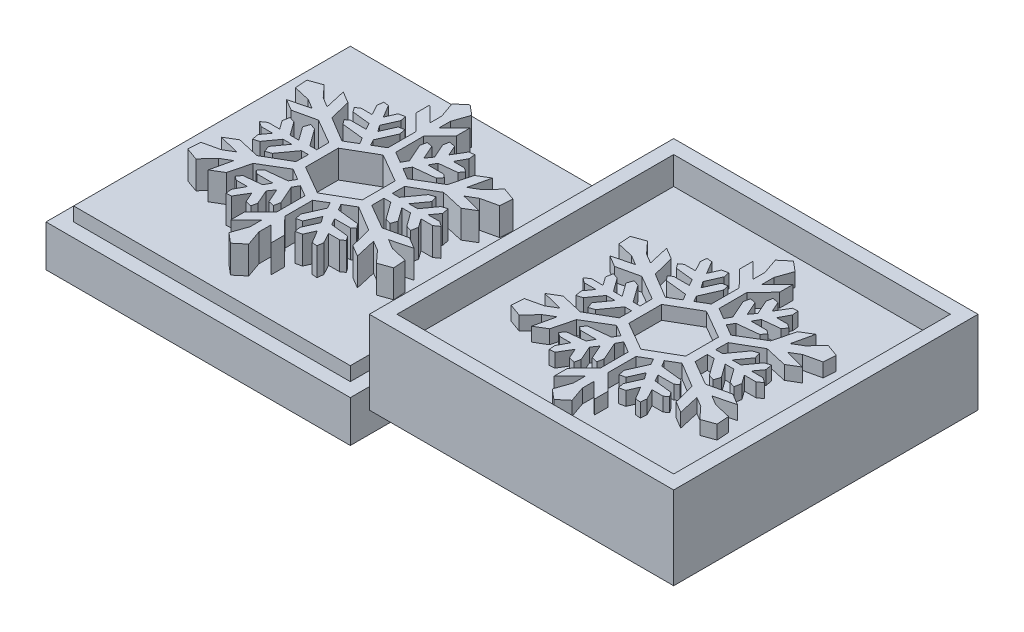
from build123d import *

# Parameters (mm, degrees)
CROQUIS1_W                                   = 110
CROQUIS1_H                                   = 110
SALIENTE_EXTRUIR1_DEPTH                      = 20
MATRIZ_START                                 = 12.5
MATRIZ_PARA_COPO_DE_NIEVE_INST_OUTLINE_W     = 110
MATRIZ_PARA_COPO_DE_NIEVE_INST_OUTLINE_H     = 110
MATRIZ_PARA_COPO_DE_NIEVE_INST_DEPTH         = 20
MATRIZ_START_2                               = 32.5
MATRIZ_PARA_COPO_DE_NIEVE_INST_2_OUTLINE_W   = 110
MATRIZ_PARA_COPO_DE_NIEVE_INST_2_OUTLINE_H   = 110
MATRIZ_PARA_COPO_DE_NIEVE_INST_2_OUTLINE_W_2 = 100
MATRIZ_PARA_COPO_DE_NIEVE_INST_2_OUTLINE_H_2 = 100
MATRIZ_PARA_COPO_DE_NIEVE_INST_2_DEPTH       = 10
MATRIZ_PARA_COPO_DE_NIEVE_INST_3_DEPTH       = 5
CROQUIS2_W                                   = 110
CROQUIS2_H                                   = 110
CROQUIS2_W_2                                 = 100
CROQUIS2_H_2                                 = 100
CORTAR_EXTRUIR2_DEPTH                        = 5
SALIENTE_EXTRUIR2_DEPTH                      = 10


# Read off the part's stored shape, not the designer's step: matriz para copo de nieve inst
with BuildPart() as part:
    # Croquis1 → Saliente-Extruir1 (new body)
    with BuildSketch(Plane(origin=(0, 0, 0), x_dir=(1, 0, 0), z_dir=(0, 1, 0))):
        Rectangle(CROQUIS1_W, CROQUIS1_H)
    extrude(amount=SALIENTE_EXTRUIR1_DEPTH)

    # Croquis2 → Cortar-Extruir2 (cut)
    with BuildSketch(Plane(origin=(0, 20, 0), x_dir=(1, 0, 0), z_dir=(0, 1, 0))):
        Rectangle(CROQUIS2_W, CROQUIS2_H)
        Rectangle(CROQUIS2_W_2, CROQUIS2_H_2, mode=Mode.SUBTRACT)
    extrude(amount=-CORTAR_EXTRUIR2_DEPTH, mode=Mode.SUBTRACT)

    # Croquis3 → Saliente-Extruir2 (add)
    with BuildSketch(Plane(origin=(0, 20, 0), x_dir=(1, 0, 0), z_dir=(0, 1, 0))):
        Polygon((1.401750865, -15.024505482), (1.401750865, -25.082026445), (7.24046247, -31.053498659), (7.24046247, -35.944123141), (1.601246458, -30.344502802), (1.601246458, -34.62741655), (3.576654108, -40.299383405), (0, -43.308998471), (-3.576654108, -40.299383405), (-1.601246458, -34.62741655), (-1.601246458, -30.344502802), (-7.24046247, -35.944123141), (-7.24046247, -31.053498659), (-1.401750865, -25.082026445), (-1.401750865, -15.024505482), (-5.366397426, -12.668526031), (-6.553491469, -14.828021821), (-3.591131353, -21.513153795), (-4.043357191, -23.757533882), (-6.088103363, -23.345532788), (-8.342582526, -18.257869523), (-9.950365645, -20.524956593), (-7.588789114, -25.854305545), (-8.008622187, -27.937921538), (-10.181938561, -27.500014507), (-11.840331452, -23.757533882), (-14.557396536, -28.329816013), (-16.453298086, -28.525494001), (-16.685581739, -26.274924382), (-14.675689124, -22.536524118), (-18.691859369, -22.536524118), (-20.099896599, -21.537965872), (-18.945472608, -19.910147), (-12.480590093, -19.217261965), (-11.178475974, -16.848528018), (-16.886571, -16.848528018), (-18.152803347, -15.857491773), (-16.886571, -14.239645438), (-9.100363099, -13.405145055), (-7.802403677, -11.220936547), (-11.840331452, -8.821409952), (-20.887971279, -14.239645438), (-22.856293838, -21.955271204), (-26.95258016, -24.408357792), (-25.240992324, -16.848528018), (-28.748223024, -18.948854976), (-32.6411281, -23.181814498), (-37.221263287, -21.537965872), (-36.924320104, -17.081609197), (-30.926257151, -15.712777024), (-27.462068783, -13.638226234), (-34.810379623, -11.763608874), (-30.680733119, -9.290544333), (-22.620463637, -11.115434525), (-13.708215403, -5.959407612), (-13.652264332, -1.511972751), (-16.150867319, -1.511972751), (-20.556839856, -7.642319112), (-22.639157972, -8.340866636), (-23.381693859, -6.127422488), (-19.896981445, -1.278891572), (-23.050573262, -1.278891572), (-26.535285676, -6.127422488), (-28.571013719, -6.810340614), (-29.01659951, -4.344064752), (-26.813613241, -1.278891572), (-31.025246179, -1.278891572), (-32.80465997, 0), (-31.025246179, 1.278891572), (-26.813613241, 1.278891572), (-29.01659951, 4.344064752), (-28.571013719, 6.810340614), (-26.535285676, 6.127422488), (-23.050573262, 1.278891572), (-19.896981445, 1.278891572), (-23.381693859, 6.127422488), (-22.639157972, 8.340866636), (-20.556839856, 7.642319112), (-16.150867319, 1.511972751), (-13.652264332, 1.511972751), (-13.708215403, 5.959407612), (-22.620463637, 11.115434525), (-30.680733119, 9.290544333), (-34.810379623, 11.763608874), (-27.462068783, 13.638226234), (-30.926257151, 15.712777024), (-36.924320104, 17.081609197), (-37.221263287, 21.537965872), (-32.6411281, 23.181814498), (-28.748223024, 18.948854976), (-25.240992324, 16.848528018), (-26.95258016, 24.408357792), (-22.856293838, 21.955271204), (-20.887971279, 14.239645438), (-11.840331452, 8.821409952), (-7.802403677, 11.220936547), (-9.100363099, 13.405145055), (-16.886571, 14.239645438), (-18.152803347, 15.857491773), (-16.886571, 16.848528018), (-11.178475974, 16.848528018), (-12.480590093, 19.217261965), (-18.945472608, 19.910147), (-20.099896599, 21.537965872), (-18.691859369, 22.536524118), (-14.675689124, 22.536524118), (-16.685581739, 26.274924382), (-16.453298086, 28.525494001), (-14.557396536, 28.329816013), (-11.840331452, 23.757533882), (-10.181938561, 27.500014507), (-8.008622187, 27.937921538), (-7.588789114, 25.854305545), (-9.950365645, 20.524956593), (-8.342582526, 18.257869523), (-6.088103363, 23.345532788), (-4.043357191, 23.757533882), (-3.591131353, 21.513153795), (-6.553491469, 14.828021821), (-5.366397426, 12.668526031), (-1.401750865, 15.024505482), (-1.401750865, 25.082026445), (-7.24046247, 31.053498659), (-7.24046247, 35.944123141), (-1.601246458, 30.344502802), (-1.601246458, 34.62741655), (-3.576654108, 40.299383405), (0, 43.308998471), (3.576654108, 40.299383405), (1.601246458, 34.62741655), (1.601246458, 30.344502802), (7.24046247, 35.944123141), (7.24046247, 31.053498659), (1.401750865, 25.082026445), (1.401750865, 15.024505482), (5.366397426, 12.668526031), (6.553491469, 14.828021821), (3.591131353, 21.513153795), (4.043357191, 23.757533882), (6.088103363, 23.345532788), (8.342582526, 18.257869523), (9.950365645, 20.524956593), (7.588789114, 25.854305545), (8.008622187, 27.937921538), (10.181938561, 27.500014507), (11.840331452, 23.757533882), (14.557396536, 28.329816013), (16.453298086, 28.525494001), (16.685581739, 26.274924382), (14.675689124, 22.536524118), (18.691859369, 22.536524118), (20.099896599, 21.537965872), (18.945472608, 19.910147), (12.480590093, 19.217261965), (11.178475974, 16.848528018), (16.886571, 16.848528018), (18.152803347, 15.857491773), (16.886571, 14.239645438), (9.100363099, 13.405145055), (7.802403677, 11.220936547), (11.840331452, 8.821409952), (20.887971279, 14.239645438), (22.856293838, 21.955271204), (26.95258016, 24.408357792), (25.240992324, 16.848528018), (28.748223024, 18.948854976), (32.6411281, 23.181814498), (37.221263287, 21.537965872), (36.924320104, 17.081609197), (30.926257151, 15.712777024), (27.462068783, 13.638226234), (34.810379623, 11.763608874), (30.680733119, 9.290544333), (22.620463637, 11.115434525), (13.708215403, 5.959407612), (13.652264332, 1.511972751), (16.150867319, 1.511972751), (20.556839856, 7.642319112), (22.639157972, 8.340866636), (23.381693859, 6.127422488), (19.896981445, 1.278891572), (23.050573262, 1.278891572), (26.535285676, 6.127422488), (28.571013719, 6.810340614), (29.01659951, 4.344064752), (26.813613241, 1.278891572), (31.025246179, 1.278891572), (32.80465997, 0), (31.025246179, -1.278891572), (26.813613241, -1.278891572), (29.01659951, -4.344064752), (28.571013719, -6.810340614), (26.535285676, -6.127422488), (23.050573262, -1.278891572), (19.896981445, -1.278891572), (23.381693859, -6.127422488), (22.639157972, -8.340866636), (20.556839856, -7.642319112), (16.150867319, -1.511972751), (13.652264332, -1.511972751), (13.708215403, -5.959407612), (22.620463637, -11.115434525), (30.680733119, -9.290544333), (34.810379623, -11.763608874), (27.462068783, -13.638226234), (30.926257151, -15.712777024), (36.924320104, -17.081609197), (37.221263287, -21.537965872), (32.6411281, -23.181814498), (28.748223024, -18.948854976), (25.240992324, -16.848528018), (26.95258016, -24.408357792), (22.856293838, -21.955271204), (20.887971279, -14.239645438), (11.840331452, -8.821409952), (7.802403677, -11.220936547), (9.100363099, -13.405145055), (16.886571, -14.239645438), (18.152803347, -15.857491773), (16.886571, -16.848528018), (11.178475974, -16.848528018), (12.480590093, -19.217261965), (18.945472608, -19.910147), (20.099896599, -21.537965872), (18.691859369, -22.536524118), (14.675689124, -22.536524118), (16.685581739, -26.274924382), (16.453298086, -28.525494001), (14.557396536, -28.329816013), (11.840331452, -23.757533882), (10.181938561, -27.500014507), (8.008622187, -27.937921538), (7.588789114, -25.854305545), (9.950365645, -20.524956593), (8.342582526, -18.257869523), (6.088103363, -23.345532788), (4.043357191, -23.757533882), (3.591131353, -21.513153795), (6.553491469, -14.828021821), (5.366397426, -12.668526031), align=None)
        Polygon((10.26956557, -5.929136446), (10.26956557, 5.929136446), (0, 11.858272893), (-10.26956557, 5.929136446), (-10.26956557, -5.929136446), (0, -11.858272893), align=None, mode=Mode.SUBTRACT)
    extrude(amount=SALIENTE_EXTRUIR2_DEPTH)


with BuildPart() as body_2:
    # matriz para copo de nieve inst outline → matriz para copo de nieve inst (new body)
    with BuildSketch(Plane(origin=(0, 0, 0), x_dir=(1, 0, 0), z_dir=(0, 1, 0)).offset(MATRIZ_START)):
        with Locations((114.843651792, 2.026652679)):
            Rectangle(MATRIZ_PARA_COPO_DE_NIEVE_INST_OUTLINE_W, MATRIZ_PARA_COPO_DE_NIEVE_INST_OUTLINE_H)
    extrude(amount=MATRIZ_PARA_COPO_DE_NIEVE_INST_DEPTH)

    # matriz para copo de nieve inst 2 outline → matriz para copo de nieve inst 2 (add)
    with BuildSketch(Plane(origin=(0, 0, 0), x_dir=(1, 0, 0), z_dir=(0, 1, 0)).offset(MATRIZ_START_2)):
        with Locations((114.843651792, 2.026652679)):
            Rectangle(MATRIZ_PARA_COPO_DE_NIEVE_INST_2_OUTLINE_W, MATRIZ_PARA_COPO_DE_NIEVE_INST_2_OUTLINE_H)
        with Locations((114.843651792, 2.026652679)):
            Rectangle(MATRIZ_PARA_COPO_DE_NIEVE_INST_2_OUTLINE_W_2, MATRIZ_PARA_COPO_DE_NIEVE_INST_2_OUTLINE_H_2, mode=Mode.SUBTRACT)
    extrude(amount=MATRIZ_PARA_COPO_DE_NIEVE_INST_2_DEPTH)

    # matriz para copo de nieve inst 3 outline → matriz para copo de nieve inst 3 (add)
    with BuildSketch(Plane(origin=(0, 0, 0), x_dir=(1, 0, 0), z_dir=(0, 1, 0)).offset(MATRIZ_START_2)):
        Polygon((116.245402657, -12.997852803), (120.210049217, -10.641873352), (121.39714326, -12.801369143), (118.434783144, -19.486501117), (118.887008983, -21.730881203), (120.931755154, -21.318880109), (123.186234317, -16.231216844), (124.794017437, -18.498303914), (122.432440905, -23.827652867), (122.852273979, -25.911268859), (125.025590352, -25.473361829), (126.683983243, -21.730881203), (129.401048328, -26.303163334), (131.296949878, -26.498841323), (131.52923353, -24.248271703), (129.519340915, -20.50987144), (133.53551116, -20.50987144), (134.94354839, -19.511313193), (133.7891244, -17.883494322), (127.324241884, -17.190609286), (126.022127765, -14.82187534), (131.730222792, -14.82187534), (132.996455139, -13.830839094), (131.730222792, -12.212992759), (123.944014891, -11.378492376), (122.646055468, -9.194283868), (126.683983243, -6.794757274), (135.73162307, -12.212992759), (137.69994563, -19.928618525), (141.796231952, -22.381705113), (140.084644115, -14.82187534), (143.591874815, -16.922202298), (147.484779892, -21.155161819), (152.064915078, -19.511313193), (151.767971896, -15.054956519), (145.769908943, -13.686124345), (142.305720574, -11.611573555), (149.654031415, -9.736956195), (145.524384911, -7.263891655), (137.464115429, -9.088781847), (128.551867195, -3.932754934), (128.495916123, 0.514679928), (130.99451911, 0.514679928), (135.400491648, -5.615666433), (137.482809764, -6.314213957), (138.22534565, -4.10076981), (134.740633236, 0.747761107), (137.894225054, 0.747761107), (141.378937468, -4.10076981), (143.41466551, -4.783687935), (143.860251301, -2.317412074), (141.657265032, 0.747761107), (145.868897971, 0.747761107), (147.648311761, 2.026652679), (145.868897971, 3.30554425), (141.657265032, 3.30554425), (143.860251301, 6.370717431), (143.41466551, 8.836993292), (141.378937468, 8.154075167), (137.894225054, 3.30554425), (134.740633236, 3.30554425), (138.22534565, 8.154075167), (137.482809764, 10.367519315), (135.400491648, 9.668971791), (130.99451911, 3.538625429), (128.495916123, 3.538625429), (128.551867195, 7.986060291), (137.464115429, 13.142087204), (145.524384911, 11.317197012), (149.654031415, 13.790261553), (142.305720574, 15.664878913), (145.769908943, 17.739429702), (151.767971896, 19.108261876), (152.064915078, 23.56461855), (147.484779892, 25.208467177), (143.591874815, 20.975507655), (140.084644115, 18.875180697), (141.796231952, 26.435010471), (137.69994563, 23.981923883), (135.73162307, 16.266298117), (126.683983243, 10.848062631), (122.646055468, 13.247589226), (123.944014891, 15.431797734), (131.730222792, 16.266298117), (132.996455139, 17.884144451), (131.730222792, 18.875180697), (126.022127765, 18.875180697), (127.324241884, 21.243914644), (133.7891244, 21.936799679), (134.94354839, 23.56461855), (133.53551116, 24.563176797), (129.519340915, 24.563176797), (131.52923353, 28.301577061), (131.296949878, 30.55214668), (129.401048328, 30.356468691), (126.683983243, 25.784186561), (125.025590352, 29.526667186), (122.852273979, 29.964574217), (122.432440905, 27.880958224), (124.794017437, 22.551609272), (123.186234317, 20.284522202), (120.931755154, 25.372185466), (118.887008983, 25.784186561), (118.434783144, 23.539806474), (121.39714326, 16.8546745), (120.210049217, 14.69517871), (116.245402657, 17.05115816), (116.245402657, 27.108679124), (122.084114261, 33.080151338), (122.084114261, 37.97077582), (116.44489825, 32.371155481), (116.44489825, 36.654069229), (118.4203059, 42.326036083), (114.843651792, 45.335651149), (111.266997684, 42.326036083), (113.242405333, 36.654069229), (113.242405333, 32.371155481), (107.603189322, 37.97077582), (107.603189322, 33.080151338), (113.441900926, 27.108679124), (113.441900926, 17.05115816), (109.477254366, 14.69517871), (108.290160323, 16.8546745), (111.252520439, 23.539806474), (110.8002946, 25.784186561), (108.755548429, 25.372185466), (106.501069266, 20.284522202), (104.893286146, 22.551609272), (107.254862678, 27.880958224), (106.835029605, 29.964574217), (104.661713231, 29.526667186), (103.00332034, 25.784186561), (100.286255255, 30.356468691), (98.390353705, 30.55214668), (98.158070053, 28.301577061), (100.167962668, 24.563176797), (96.151792423, 24.563176797), (94.743755193, 23.56461855), (95.898179184, 21.936799679), (102.363061699, 21.243914644), (103.665175818, 18.875180697), (97.957080791, 18.875180697), (96.690848444, 17.884144451), (97.957080791, 16.266298117), (105.743288692, 15.431797734), (107.041248115, 13.247589226), (103.00332034, 10.848062631), (93.955680513, 16.266298117), (91.987357953, 23.981923883), (87.891071631, 26.435010471), (89.602659468, 18.875180697), (86.095428768, 20.975507655), (82.202523691, 25.208467177), (77.622388505, 23.56461855), (77.919331687, 19.108261876), (83.917394641, 17.739429702), (87.381583009, 15.664878913), (80.033272168, 13.790261553), (84.162918672, 11.317197012), (92.223188154, 13.142087204), (101.135436388, 7.986060291), (101.19138746, 3.538625429), (98.692784473, 3.538625429), (94.286811935, 9.668971791), (92.20449382, 10.367519315), (91.461957933, 8.154075167), (94.946670347, 3.30554425), (91.793078529, 3.30554425), (88.308366115, 8.154075167), (86.272638073, 8.836993292), (85.827052282, 6.370717431), (88.030038551, 3.30554425), (83.818405612, 3.30554425), (82.038991822, 2.026652679), (83.818405612, 0.747761107), (88.030038551, 0.747761107), (85.827052282, -2.317412074), (86.272638073, -4.783687935), (88.308366115, -4.10076981), (91.793078529, 0.747761107), (94.946670347, 0.747761107), (91.461957933, -4.10076981), (92.20449382, -6.314213957), (94.286811935, -5.615666433), (98.692784473, 0.514679928), (101.19138746, 0.514679928), (101.135436388, -3.932754934), (92.223188154, -9.088781847), (84.162918672, -7.263891655), (80.033272168, -9.736956195), (87.381583009, -11.611573555), (83.917394641, -13.686124345), (77.919331687, -15.054956519), (77.622388505, -19.511313193), (82.202523691, -21.155161819), (86.095428768, -16.922202298), (89.602659468, -14.82187534), (87.891071631, -22.381705113), (91.987357953, -19.928618525), (93.955680513, -12.212992759), (103.00332034, -6.794757274), (107.041248115, -9.194283868), (105.743288692, -11.378492376), (97.957080791, -12.212992759), (96.690848444, -13.830839094), (97.957080791, -14.82187534), (103.665175818, -14.82187534), (102.363061699, -17.190609286), (95.898179184, -17.883494322), (94.743755193, -19.511313193), (96.151792423, -20.50987144), (100.167962668, -20.50987144), (98.158070053, -24.248271703), (98.390353705, -26.498841323), (100.286255255, -26.303163334), (103.00332034, -21.730881203), (104.661713231, -25.473361829), (106.835029605, -25.911268859), (107.254862678, -23.827652867), (104.893286146, -18.498303914), (106.501069266, -16.231216844), (108.755548429, -21.318880109), (110.8002946, -21.730881203), (111.252520439, -19.486501117), (108.290160323, -12.801369143), (109.477254366, -10.641873352), (113.441900926, -12.997852803), (113.441900926, -23.055373767), (107.603189322, -29.02684598), (107.603189322, -33.917470462), (113.242405333, -28.317850124), (113.242405333, -32.600763871), (111.266997684, -38.272730726), (114.843651792, -41.282345792), (118.4203059, -38.272730726), (116.44489825, -32.600763871), (116.44489825, -28.317850124), (122.084114261, -33.917470462), (122.084114261, -29.02684598), (116.245402657, -23.055373767), align=None)
        Polygon((125.113217362, 7.955789125), (125.113217362, -3.902483768), (114.843651792, -9.831620214), (104.574086222, -3.902483768), (104.574086222, 7.955789125), (114.843651792, 13.884925571), align=None, mode=Mode.SUBTRACT)
    extrude(amount=MATRIZ_PARA_COPO_DE_NIEVE_INST_3_DEPTH)


solid = Compound([part.part, body_2.part])
